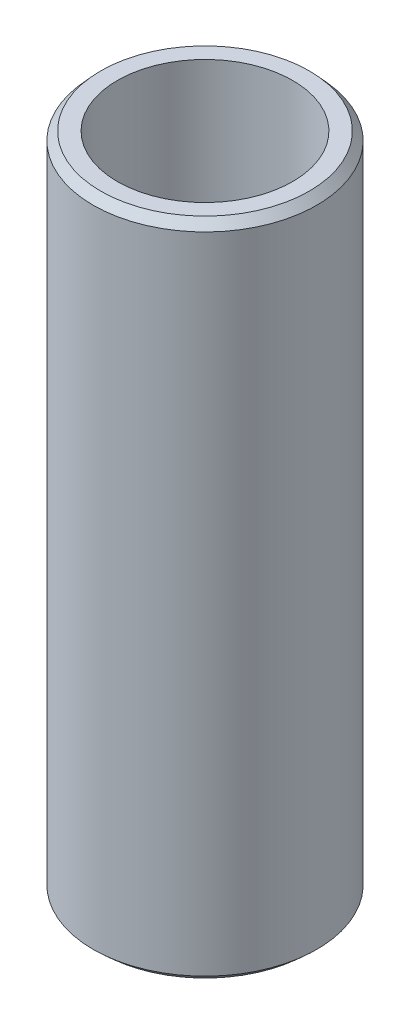
from build123d import *
from OCP.BRepFilletAPI import BRepFilletAPI_MakeChamfer

# Parameters (mm, degrees)
SKETCH1_R           = 37.5
BOSS_EXTRUDE1_DEPTH = 221.48046516
SKETCH2_R           = 29.396676792
CUT_EXTRUDE1_DEPTH  = 228.741292803
CHAMFER1_SIZE       = 2.810670011
CHAMFER1_SIZE2      = 2.542114129


with BuildPart() as part:
    # Sketch1 → Boss-Extrude1 (new body)
    with BuildSketch(Plane(origin=(0, 0, 0), x_dir=(1, 0, 0), z_dir=(0, 1, 0))):
        Circle(SKETCH1_R)
    extrude(amount=BOSS_EXTRUDE1_DEPTH)

    # Sketch2 → Cut-Extrude1 (cut, through all)
    with BuildSketch(Plane(origin=(0, 0, 0), x_dir=(1, 0, 0), z_dir=(0, 1, 0))):
        Circle(SKETCH2_R)
    extrude(amount=CUT_EXTRUDE1_DEPTH, mode=Mode.SUBTRACT)

    # Chamfer1: one chamfer whose edges measure the first distance from different faces: ONE call of the kernel's chamfer builder (chamfer() names one face for all edges)
    chamfer1_edges_1 = [part.edges().sort_by_distance(p)[0] for p in [
        (-37.5, 221.48046516, 0),
    ]]
    chamfer1_side_1 = [part.faces().sort_by_distance(p)[0] for p in [
        (-37.5, 110.74023258, 0),
    ]]
    chamfer1_edges_2 = [part.edges().sort_by_distance(p)[0] for p in [
        (-37.5, 0, 0),
    ]]
    chamfer1_side_2 = [part.faces().sort_by_distance(p)[0] for p in [
        (-36.439339828, 0, 0),
    ]]
    chamfer1 = BRepFilletAPI_MakeChamfer(part.part.solid().wrapped)
    for e in chamfer1_edges_1:
        chamfer1.Add(CHAMFER1_SIZE, CHAMFER1_SIZE2, e.wrapped, chamfer1_side_1[0].wrapped)  # the first distance lies on this face
    for e in chamfer1_edges_2:
        chamfer1.Add(CHAMFER1_SIZE, CHAMFER1_SIZE2, e.wrapped, chamfer1_side_2[0].wrapped)  # the first distance lies on this face
    add(Compound.cast(chamfer1.Shape()), mode=Mode.REPLACE)


solid = part.part
